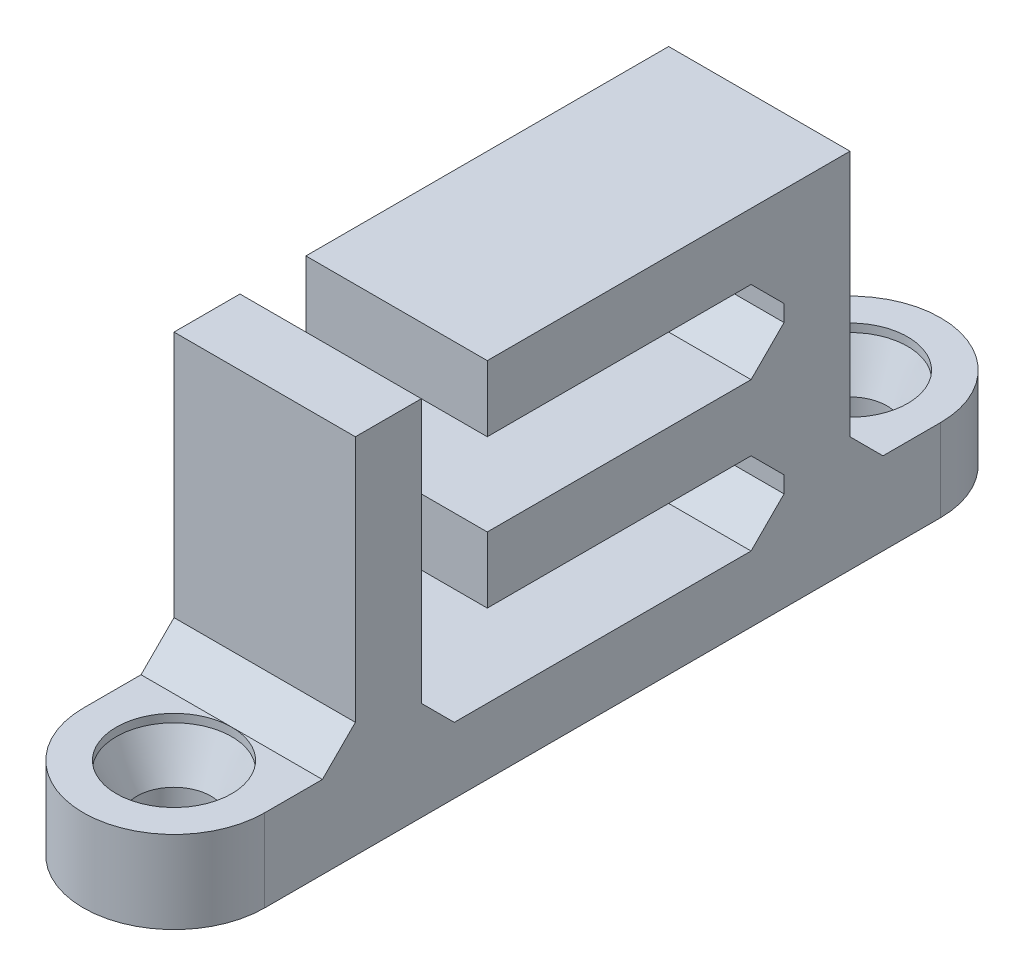
from build123d import *
from OCP.BRepFilletAPI import BRepFilletAPI_MakeChamfer

# Parameters (mm, degrees)
SKETCH1_W           = 30
SKETCH1_H           = 58
SKETCH1_W_2         = 22
SKETCH1_H_2         = 5
BOSS_EXTRUDE1_DEPTH = 11
CUT_EXTRUDE2_START  = -49
SKETCH2_W           = 11
SKETCH2_H           = 4
CUT_EXTRUDE2_DEPTH  = 49
SKETCH3_R           = 2.25
BOSS_EXTRUDE2_DEPTH = 5
SKETCH4_R           = 3.5
CUT_EXTRUDE3_DEPTH  = 3
CHAMFER1_SIZE       = 2.5
CHAMFER1_SIZE_2     = 1.25
CHAMFER2_SIZE       = 2
SKETCH6_W           = 39.025206684
SKETCH6_H           = 36
CUT_EXTRUDE5_DEPTH  = 72.874891304


with BuildPart() as part:
    # Sketch1 → Boss-Extrude1 (new body)
    with BuildSketch(Plane(origin=(0, 0, 0), x_dir=(0, 0, -1), z_dir=(1, 0, 0))):
        with Locations((15, 29)):
            Rectangle(SKETCH1_W, SKETCH1_H)
        with Locations((15, 42.5)):
            Rectangle(SKETCH1_W_2, SKETCH1_H_2, mode=Mode.SUBTRACT)
        with Locations((15, 6.5)):
            Rectangle(SKETCH1_W_2, SKETCH1_H_2, mode=Mode.SUBTRACT)
        with Locations((15, 15.5)):
            Rectangle(SKETCH1_W_2, SKETCH1_H_2, mode=Mode.SUBTRACT)
        with Locations((15, 51.5)):
            Rectangle(SKETCH1_W_2, SKETCH1_H_2, mode=Mode.SUBTRACT)
        with Locations((15, 33.5)):
            Rectangle(SKETCH1_W_2, SKETCH1_H_2, mode=Mode.SUBTRACT)
        with Locations((15, 24.5)):
            Rectangle(SKETCH1_W_2, SKETCH1_H_2, mode=Mode.SUBTRACT)
    extrude(amount=BOSS_EXTRUDE1_DEPTH)

    # Sketch2 → Cut-Extrude2 (cut)
    with BuildSketch(Plane(origin=(0, 58, 0), x_dir=(1, 0, 0), z_dir=(0, 1, 0)).offset(CUT_EXTRUDE2_START)):
        with Locations((5.5, 6)):
            Rectangle(SKETCH2_W, SKETCH2_H)
    extrude(amount=CUT_EXTRUDE2_DEPTH, mode=Mode.SUBTRACT)

    # Sketch3 → Boss-Extrude2 (add)
    # profile 1 of 2: a face of its own
    with BuildSketch(Plane(origin=(0, 0, 0), x_dir=(1, 0, 0), z_dir=(0, 1, 0))):
        with BuildLine():
            Line((0, 0), (0, -5.5))
            ThreePointArc((0, -5.5), (5.5, -11), (11, -5.5))
            Line((11, -5.5), (11, 0))
            Line((11, 0), (0, 0))
        make_face()
        with Locations(Location((5.5, -5.5, 0), (0, 0, 270))):
            Circle(SKETCH3_R, mode=Mode.SUBTRACT)
    # profile 2 of 2: a face of its own
    with BuildSketch(Plane(origin=(0, 0, 0), x_dir=(1, 0, 0), z_dir=(0, 1, 0))):
        with BuildLine():
            Line((11, 35.5), (11, 30))
            Line((11, 30), (0, 30))
            Line((0, 30), (0, 35.5))
            ThreePointArc((0, 35.5), (5.5, 41), (11, 35.5))
        make_face()
        with Locations(Location((5.5, 35.5, 0), (0, 0, 270))):
            Circle(SKETCH3_R, mode=Mode.SUBTRACT)
    extrude(amount=BOSS_EXTRUDE2_DEPTH)

    # Sketch4 → Cut-Extrude3 (cut)
    with BuildSketch(Plane(origin=(0, 5, 0), x_dir=(1, 0, 0), z_dir=(0, 1, 0))):
        with Locations(Location((5.5, -5.5, 0), (0, 0, 270))):
            Circle(SKETCH4_R)
        with Locations(Location((5.5, 35.5, 0), (0, 0, 270))):
            Circle(SKETCH4_R)
    extrude(amount=-CUT_EXTRUDE3_DEPTH, mode=Mode.SUBTRACT)

    # Chamfer1
    chamfer1_edges_1 = [part.edges().sort_by_distance(p)[0] for p in [
        (5.5, 2, 2),
    ]]
    chamfer1_side_1 = [part.faces().sort_by_distance(p)[0] for p in [
        (5.5, 2.025, 2),
    ]]
    chamfer1_edges_2 = [part.edges().sort_by_distance(p)[0] for p in [
        (5.5, 2, -39),
    ]]
    chamfer1_side_2 = [part.faces().sort_by_distance(p)[0] for p in [
        (5.5, 2.025, -39),
    ]]
    chamfer1 = BRepFilletAPI_MakeChamfer(part.part.solid().wrapped)
    for e in chamfer1_edges_1:
        chamfer1.Add(CHAMFER1_SIZE - 0.0001, CHAMFER1_SIZE_2 - 0.0001, e.wrapped, chamfer1_side_1[0].wrapped)
    for e in chamfer1_edges_2:
        chamfer1.Add(CHAMFER1_SIZE - 0.0001, CHAMFER1_SIZE_2 - 0.0001, e.wrapped, chamfer1_side_2[0].wrapped)
    add(Compound.cast(chamfer1.Shape()), mode=Mode.REPLACE)  # a hair under: the kernel refuses the full size

    # Chamfer2
    chamfer2_edges = [part.edges().sort_by_distance(p)[0] for p in [
        (5.5, 5, 0),
        (5.5, 5, -30),
        (5.5, 4, -4),
        (5.5, 4, -26),
        (5.5, 9, -26),
        (5.5, 40, -26),
        (5.5, 45, -26),
        (5.5, 13, -26),
        (5.5, 18, -26),
        (5.5, 54, -26),
        (5.5, 49, -26),
        (5.5, 36, -26),
        (5.5, 31, -26),
        (5.5, 22, -26),
        (5.5, 27, -26),
    ]]
    chamfer(chamfer2_edges, length=CHAMFER2_SIZE - 0.0001)  # a hair under: the kernel refuses the full size

    # Sketch6 → Cut-Extrude5 (cut, through all)
    with BuildSketch(Plane.ZY):
        with Locations((-14.453310682, 40)):
            Rectangle(SKETCH6_W, SKETCH6_H)
    extrude(amount=-CUT_EXTRUDE5_DEPTH, mode=Mode.SUBTRACT)


solid = part.part
